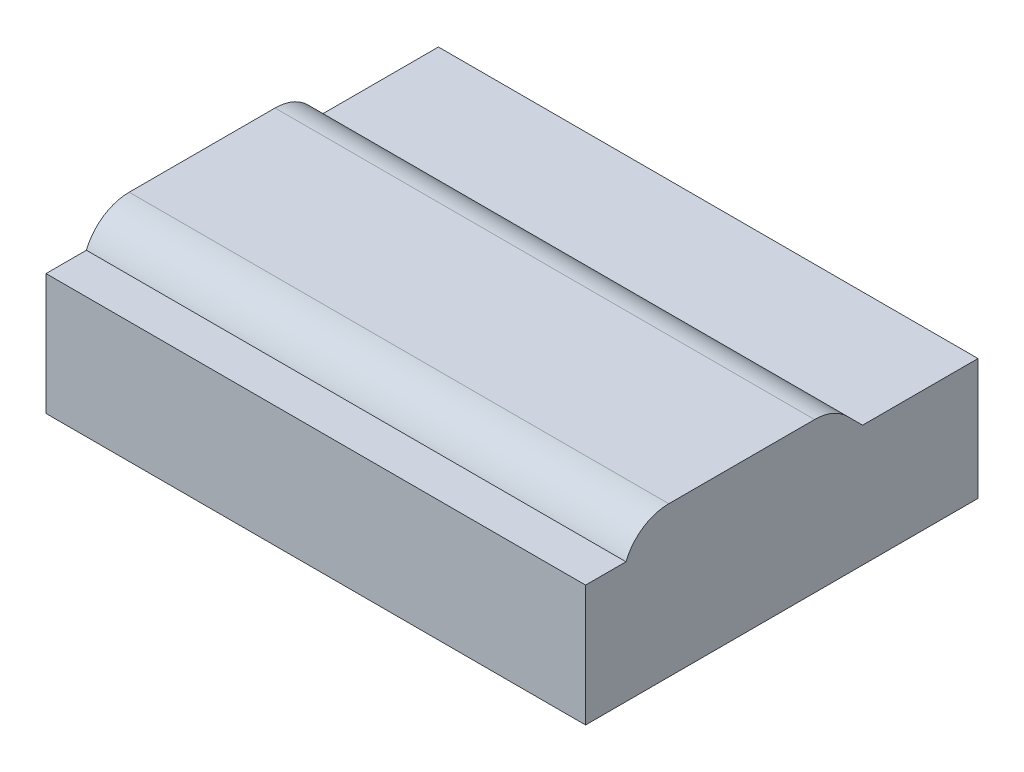
from build123d import *

# Parameters (mm, degrees)
SKETCH1_W           = 935
SKETCH1_H           = 680
BOSS_EXTRUDE1_DEPTH = 210
BOSS_EXTRUDE2_DEPTH = 935
FILLET1_R           = 80


with BuildPart() as part:
    # Sketch1 → Boss-Extrude1 (new body)
    with BuildSketch(Plane(origin=(0, 0, 0), x_dir=(1, 0, 0), z_dir=(0, 1, 0))):
        with Locations((0, 340)):
            Rectangle(SKETCH1_W, SKETCH1_H)
    extrude(amount=-BOSS_EXTRUDE1_DEPTH)

    # Sketch3 → Boss-Extrude2 (add)
    with BuildSketch(Plane.ZY.offset(467.5)):
        Polygon((-70, 0), (-70, 50), (-430, 50), (-480, 0), align=None)
    extrude(amount=-BOSS_EXTRUDE2_DEPTH)

    # Fillet1
    # the kernel refuses this fillet: 80 mm, written as the material it takes off along each edge
    with BuildSketch(Plane(origin=(-652.904962177, 50, -70), x_dir=(0, -1, 0), z_dir=(1, 0, 0))) as fillet1_piece_1:
        with BuildLine():
            CenterArc((80, 74.161984871), FILLET1_R, 180, 67.975687163)
            Line((0, 74.161984871), (-1.6, 74.161984871))
            Line((-1.6, 74.161984871), (-1.6, 0))
            Line((-1.6, 0), (0, -1.6))
            ThreePointArc((0, -1.6), (25, -1.6), (49.4, -1.483239697))
            Line((49.4, -1.483239697), (50, 0))
        make_face()
    extrude(amount=1305.809924355, mode=Mode.SUBTRACT)
    with BuildSketch(Plane(origin=(-550.342712475, 50, -430), x_dir=(0, -0.7071067811865477, -0.7071067811865474), z_dir=(1, 0, 0))) as fillet1_piece_2:
        with BuildLine():
            CenterArc((FILLET1_R * 0.414213562373, -FILLET1_R), FILLET1_R, 90, 45)
            Line((-FILLET1_R * 0.292893218813, -FILLET1_R * 0.292893218813), (-FILLET1_R * 0.307035354437, -FILLET1_R * 0.27875108319))
            Line((-FILLET1_R * 0.307035354437, -FILLET1_R * 0.27875108319), (-FILLET1_R * 0.00828427124746, FILLET1_R * 0.02))
            Line((-FILLET1_R * 0.00828427124746, FILLET1_R * 0.02), (FILLET1_R * 0.414213562373, FILLET1_R * 0.02))
            Line((FILLET1_R * 0.414213562373, FILLET1_R * 0.02), (FILLET1_R * 0.414213562373, 0))
        make_face()
    extrude(amount=1100.685424949, mode=Mode.SUBTRACT)


solid = part.part
